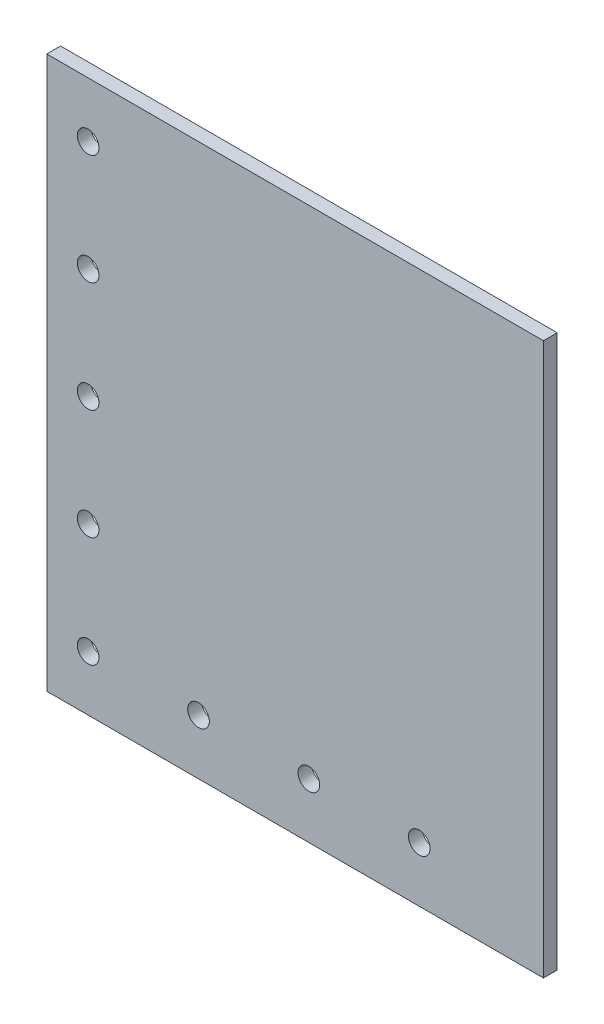
from build123d import *

# Parameters (mm, degrees)
SKETCH1_R           = 2.4892
BOSS_EXTRUDE1_DEPTH = 1.5875


with BuildPart() as part:
    # Sketch1 → Boss-Extrude1 (new, symmetric)
    with BuildSketch(Plane.XY):
        Polygon((0, 127), (0, 0), (114.3, 0), (114.3, 25.4), (114.3, 127), align=None)
        with Locations((85.725, 12.7)):
            Circle(SKETCH1_R, mode=Mode.SUBTRACT)
        with Locations((60.325, 12.7)):
            Circle(SKETCH1_R, mode=Mode.SUBTRACT)
        with Locations((34.925, 12.7)):
            Circle(SKETCH1_R, mode=Mode.SUBTRACT)
        with Locations((9.525, 12.7)):
            Circle(SKETCH1_R, mode=Mode.SUBTRACT)
        with Locations((9.525, 38.1)):
            Circle(SKETCH1_R, mode=Mode.SUBTRACT)
        with Locations((9.525, 63.5)):
            Circle(SKETCH1_R, mode=Mode.SUBTRACT)
        with Locations((9.525, 88.9)):
            Circle(SKETCH1_R, mode=Mode.SUBTRACT)
        with Locations((9.525, 114.3)):
            Circle(SKETCH1_R, mode=Mode.SUBTRACT)
    extrude(amount=BOSS_EXTRUDE1_DEPTH, both=True)


solid = part.part
